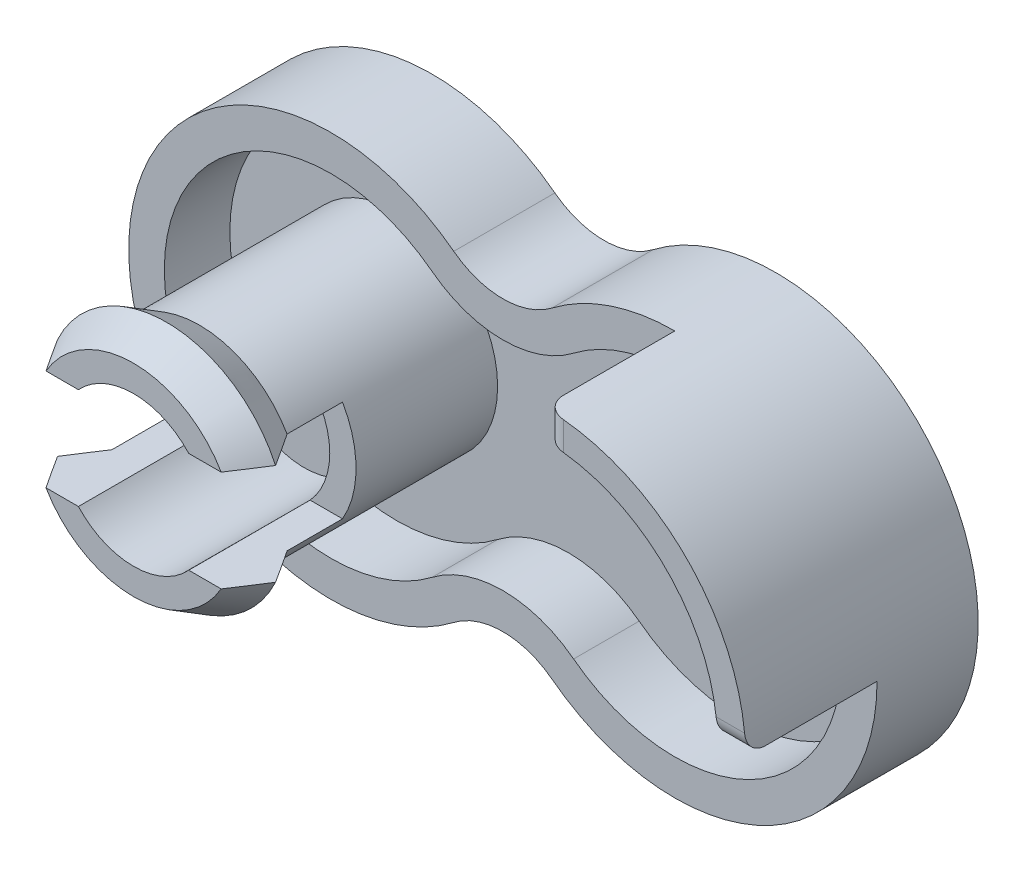
from build123d import *
from build123d.topology import SkipClean

# Parameters (mm, degrees)
BOSS_EXTRUDE1_DEPTH = 2.5
SHELL1_T            = -0.88
BOSS_EXTRUDE2_DEPTH = 3.25
FILLET1_R           = 0.5
FILLET2_R           = 0.5
SKETCH3_R           = 2.5
BOSS_EXTRUDE3_DEPTH = 6.5
SKETCH5_R           = 1.85
CUT_EXTRUDE1_DEPTH  = 4.22
SKETCH8_W           = 6.47168307
SKETCH8_H           = 2.5
CUT_EXTRUDE2_DEPTH  = 3
SKETCH9_W           = 5
SKETCH9_H           = 5
CUT_EXTRUDE3_DEPTH  = 3.25


# Read off the part's stored shape, not the designer's step: Mirror1
with BuildPart() as part:
    # Sketch1 → Boss-Extrude1 (new body)
    with BuildSketch(Plane.XY):
        with BuildLine():
            ThreePointArc((3.035714286, 3.972963475), (-5, 0), (3.035714286, -3.972963475))
            ThreePointArc((3.035714286, -3.972963475), (4.25, -3.562148865), (5.464285714, -3.972963475))
            ThreePointArc((5.464285714, -3.972963475), (13.5, 0), (5.464285714, 3.972963475))
            ThreePointArc((5.464285714, 3.972963475), (4.25, 3.562148865), (3.035714286, 3.972963475))
        make_face()
    extrude(amount=BOSS_EXTRUDE1_DEPTH)

    # Shell1
    shell1_openings = [part.faces().sort_by_distance(p)[0] for p in [
        (4.25, 0, 2.5),
    ]]
    offset(amount=SHELL1_T, openings=shell1_openings, kind=Kind.INTERSECTION)

    # Sketch2 → Boss-Extrude2 (add)
    with BuildSketch(Plane.XY.offset(2.5)):
        with BuildLine():
            Line((13.5, 0), (12.8, 0))
            ThreePointArc((12.8, 0), (11.540559159, -3.040559159), (8.5, -4.3))
            Line((8.5, -4.3), (8.5, -5))
            ThreePointArc((8.5, -5), (12.035533906, -3.535533906), (13.5, 0))
        make_face()
    extrude(amount=BOSS_EXTRUDE2_DEPTH)

    # Fillet1
    fillet1_edges = [part.edges().sort_by_distance(p)[0] for p in [
        (8.5, -4.65, 5.75),
    ]]
    fillet(fillet1_edges, radius=FILLET1_R)

    # Fillet2
    fillet2_edges = [part.edges().sort_by_distance(p)[0] for p in [
        (13.15, 0, 5.75),
    ]]
    fillet(fillet2_edges, radius=FILLET2_R)

    # Sketch3 → Boss-Extrude3 (add)
    with BuildSketch(Plane.XY.offset(0.88)):
        with Locations(Location((0, 0, 0), (0, 0, 180))):
            Circle(SKETCH3_R)
    extrude(amount=BOSS_EXTRUDE3_DEPTH)

    # Sketch5 → Cut-Extrude1 (cut)
    with BuildSketch(Plane.XY.offset(7.38)):
        Circle(SKETCH5_R)
    extrude(amount=-CUT_EXTRUDE1_DEPTH, mode=Mode.SUBTRACT)

    # Sketch6 → Revolve1 (revolve)
    with BuildSketch(Plane(origin=(0, 0, 0), x_dir=(1, 0, 0), z_dir=(0, 1, 0))):
        Polygon((2.5, -5.75), (2.5, -7.38), (2.970540469, -6.565), align=None)
    revolve(axis=Axis((0, 0, 7.38), (0, 0, -1)))

    # Sketch8 → Cut-Extrude2 (cut)
    with BuildSketch(Plane.XY.offset(7.38)):
        Rectangle(SKETCH8_W, SKETCH8_H)
    extrude(amount=-CUT_EXTRUDE2_DEPTH, mode=Mode.SUBTRACT)

    # Mirror1: part across plane


with BuildPart() as part_1:
    with SkipClean():  # the faces are left unmerged after this step: merging them gives an invalid solid
        add(part.part)
        add(part.part.mirror(Plane.ZX))

    # Sketch9 → Cut-Extrude3 (cut)
    with SkipClean():  # the faces are left unmerged after this step: merging them gives an invalid solid
        with BuildSketch(Plane.XY.offset(5.75)):
            with Locations((11, -2.5)):
                Rectangle(SKETCH9_W, SKETCH9_H)
        extrude(amount=-CUT_EXTRUDE3_DEPTH, mode=Mode.SUBTRACT)


solid = part_1.part
